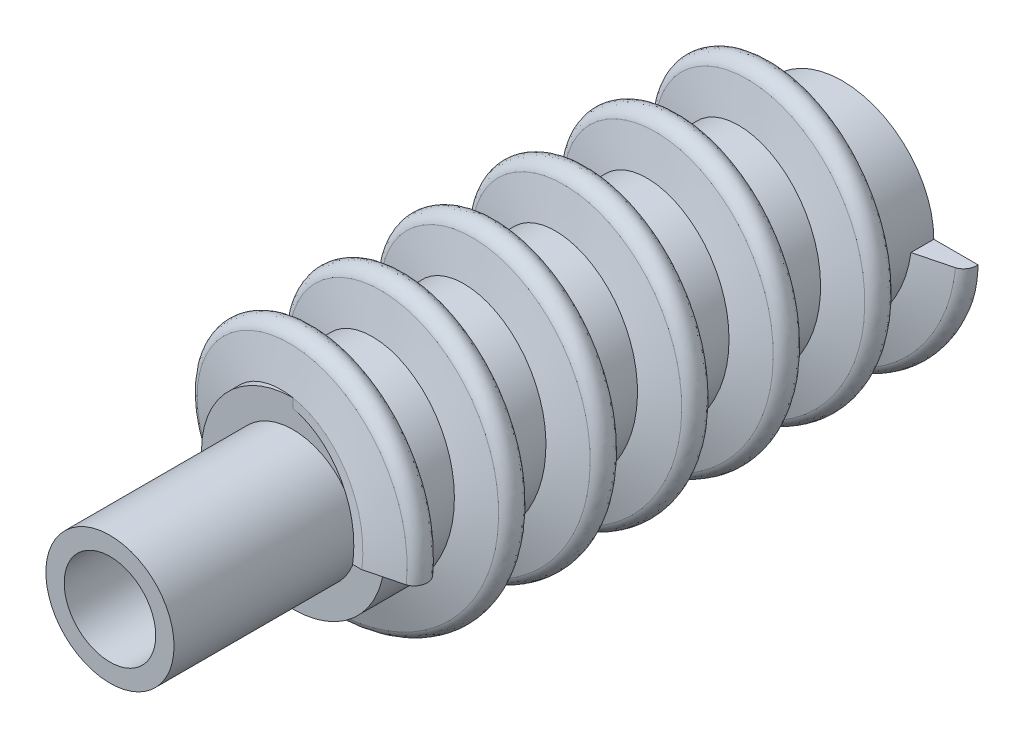
from build123d import *

# Parameters (mm, degrees)
SKETCH1_R           = 5
BOSS_EXTRUDE1_DEPTH = 30
SKETCH2_R           = 3.5
SKETCH2_R_2         = 2.5
BOSS_EXTRUDE2_DEPTH = 10
SWEEP2_PITCH        = 5
SKETCH36_W          = 16.138573072
SKETCH36_H          = 1.452154374
CUT_EXTRUDE2_DEPTH  = 16


with BuildPart() as part:
    # Sketch1 → Boss-Extrude1 (new body)
    with BuildSketch(Plane.XY):
        Circle(SKETCH1_R)
    extrude(amount=BOSS_EXTRUDE1_DEPTH)

    # Sketch2 → Boss-Extrude2 (add)
    with BuildSketch(Plane.XY.offset(30)):
        Circle(SKETCH2_R)
        Circle(SKETCH2_R_2, mode=Mode.SUBTRACT)
    extrude(amount=BOSS_EXTRUDE2_DEPTH)

    # Sweep2: arcs per turn and ends read off the stored shape
    # Sweep2: the profile of Sketch7 screwed along a left-hand helix through 6 turns, 12 arcs to a turn; built about Z, then put on its axis
    sweep2_z = Axis((0, 0, 0), (0, 0, 1))
    sweep2_corners = [(5, 0, -1.25), (4.5, 0, -1.25), (4.5, 0, 1.25), (5, 0, 1.25), (6.937469481, 0, 0.75380245), (7.41736908, 0, 0.059940013), (6.891289455, 0, -0.599596896)]
    with BuildLine(mode=Mode.PRIVATE) as sweep2_profile:
        Line(sweep2_corners[0], sweep2_corners[1])
        Line(sweep2_corners[1], sweep2_corners[2])
        Line(sweep2_corners[2], sweep2_corners[3])
        Line(sweep2_corners[3], sweep2_corners[4])
        Line(sweep2_corners[6], sweep2_corners[0])
        ThreePointArc((6.937469481, 0, 0.75380245), (7.292234254, 0, 0.486281295), (7.41736908, 0, 0.059940013))
        ThreePointArc((7.41736908, 0, 0.059940013), (7.263464319, 0, -0.356880017), (6.891289455, 0, -0.599596896))
    sweep2_cap = Face(sweep2_profile.wire())
    sweep2_arcs = [((6.937469481, 0, 0.75380245), (7.435292612, 0, 0.585225473), (7.41736908, 0, 0.059940013), (1, 0.8025743871723363, 1)), ((7.41736908, 0, 0.059940013), (7.399445548, 0, -0.465345446), (6.891289455, 0, -0.599596896), (1, 0.8025743871723363, 1))]  # start, shoulder, end, weights
    sweep2_turn_angles = [0, -15, -30, -45, -60, -75, -90, -105, -120, -135, -150, -165, -180, -195, -210, -225, -240, -255, -270, -285, -300, -315, -330, -345, -360]
    sweep2_turn_weights = [1, 0.9659258262890683, 1, 0.9659258262890683, 1, 0.9659258262890683, 1, 0.9659258262890683, 1, 0.9659258262890683, 1, 0.9659258262890683, 1, 0.9659258262890683, 1, 0.9659258262890683, 1, 0.9659258262890683, 1, 0.9659258262890683, 1, 0.9659258262890683, 1, 0.9659258262890683, 1]
    sweep2_turn_rails = [Edge.make_bspline([Vector(p[0], p[1], 0).rotate(sweep2_z, sweep2_turn_angles[k]) / sweep2_turn_weights[k] + Vector(0, 0, p[2] + -SWEEP2_PITCH * sweep2_turn_angles[k] / 360) for k in range(25)], [0, 0, 0, 1, 1, 2, 2, 3, 3, 4, 4, 5, 5, 6, 6, 7, 7, 8, 8, 9, 9, 10, 10, 11, 11, 12, 12, 12], 2, sweep2_turn_weights) for p in sweep2_corners]
    sweep2_turn_sides = [*[Face.make_surface_from_curves(sweep2_turn_rails[p[0]], sweep2_turn_rails[p[1]]) for p in [(0, 1), (1, 2), (2, 3), (3, 4), (6, 0)]], *[Face.make_bezier_surface([[Vector(p[j][0], p[j][1], 0).rotate(sweep2_z, sweep2_turn_angles[2 * i + k]) / sweep2_turn_weights[2 * i + k] + Vector(0, 0, p[j][2] + -SWEEP2_PITCH * sweep2_turn_angles[2 * i + k] / 360) for k in range(3)] for j in range(3)], [[p[3][j] * sweep2_turn_weights[2 * i + k] for k in range(3)] for j in range(3)]) for p in sweep2_arcs for i in range(12)]]
    sweep2 = Plane(origin=(0, 0, 0), x_dir=(1, 0, 0), z_dir=(0, 0, 1)) * Solid(Shell([*[p.moved(Location((0, 0, SWEEP2_PITCH * i))) for i in range(6) for p in sweep2_turn_sides], sweep2_cap, sweep2_cap.rotate(sweep2_z, -2160).moved(Location((0, 0, -SWEEP2_PITCH * -2160 / 360)))]))
    add(sweep2)

    # Sketch36 → Cut-Extrude2 (cut)
    with BuildSketch(Plane(origin=(0, 0, 0), x_dir=(1, 0, 0), z_dir=(0, 1, 0))):
        with Locations((3.069286536, 0.726077187)):
            Rectangle(SKETCH36_W, SKETCH36_H)
    extrude(amount=-CUT_EXTRUDE2_DEPTH, mode=Mode.SUBTRACT)


solid = part.part
